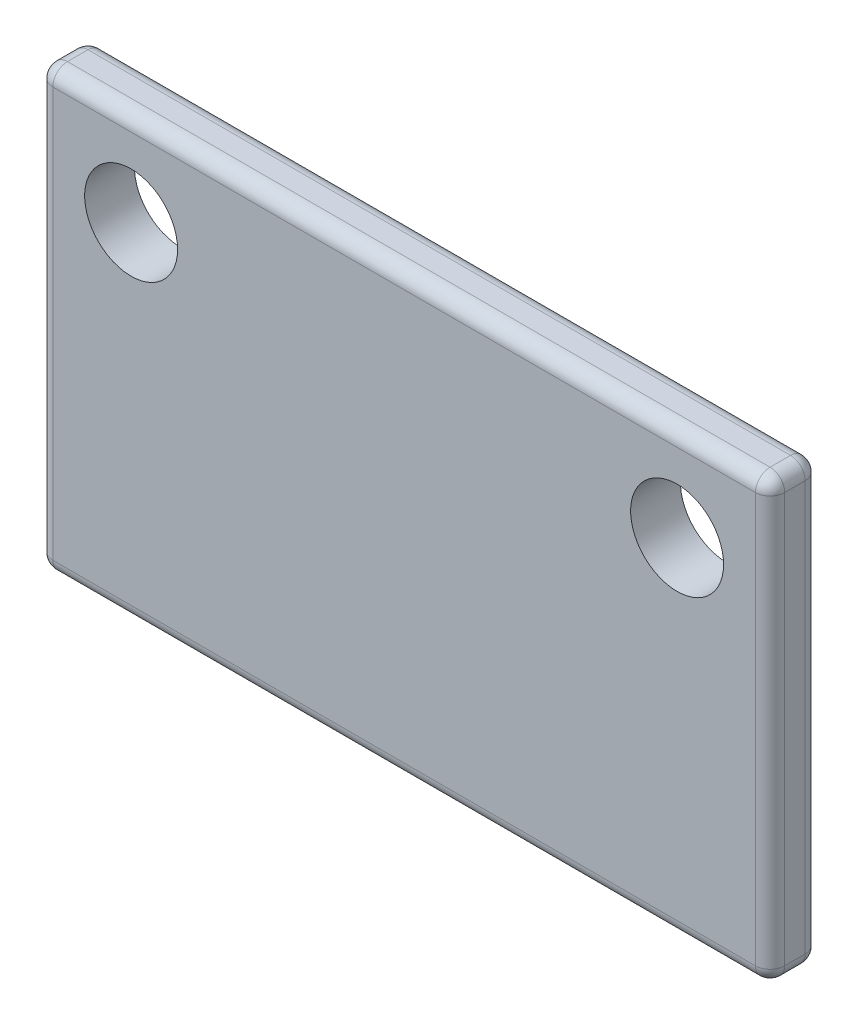
from build123d import *

# Parameters (mm, degrees)
ESBO_O1_W                = 25
ESBO_O1_H                = 15
RESSALTO_EXTRUS_O1_DEPTH = 1.7
ESBO_O2_R                = 1.5875
CORTE_EXTRUS_O1_DEPTH    = 15.676171163
FILETE2_R                = 0.5


with BuildPart() as part:
    # Esboço1 → Ressalto-extrusão1 (new body)
    with BuildSketch(Plane.XY):
        Rectangle(ESBO_O1_W, ESBO_O1_H)
    extrude(amount=RESSALTO_EXTRUS_O1_DEPTH)

    # Esboço2 → Corte-extrusão1 (cut, through all)
    with BuildSketch(Plane.XY.offset(1.7)):
        with Locations((-9.325, 4.325)):
            Circle(ESBO_O2_R)
        with Locations((9.325, 4.325)):
            Circle(ESBO_O2_R)
    extrude(amount=-CORTE_EXTRUS_O1_DEPTH, mode=Mode.SUBTRACT)

    # Filete2
    filete2_edges = [part.edges().sort_by_distance(p)[0] for p in [
        (0, -7.5, 0),
        (12.5, 0, 0),
        (-12.5, 0, 1.7),
        (0, -7.5, 1.7),
        (12.5, 0, 1.7),
        (0, 7.5, 1.7),
        (12.5, 7.5, 0.85),
        (12.5, -7.5, 0.85),
        (-12.5, -7.5, 0.85),
        (-12.5, 7.5, 0.85),
        (-12.5, 0, 0),
        (0, 7.5, 0),
    ]]
    fillet(filete2_edges, radius=FILETE2_R)


solid = part.part
